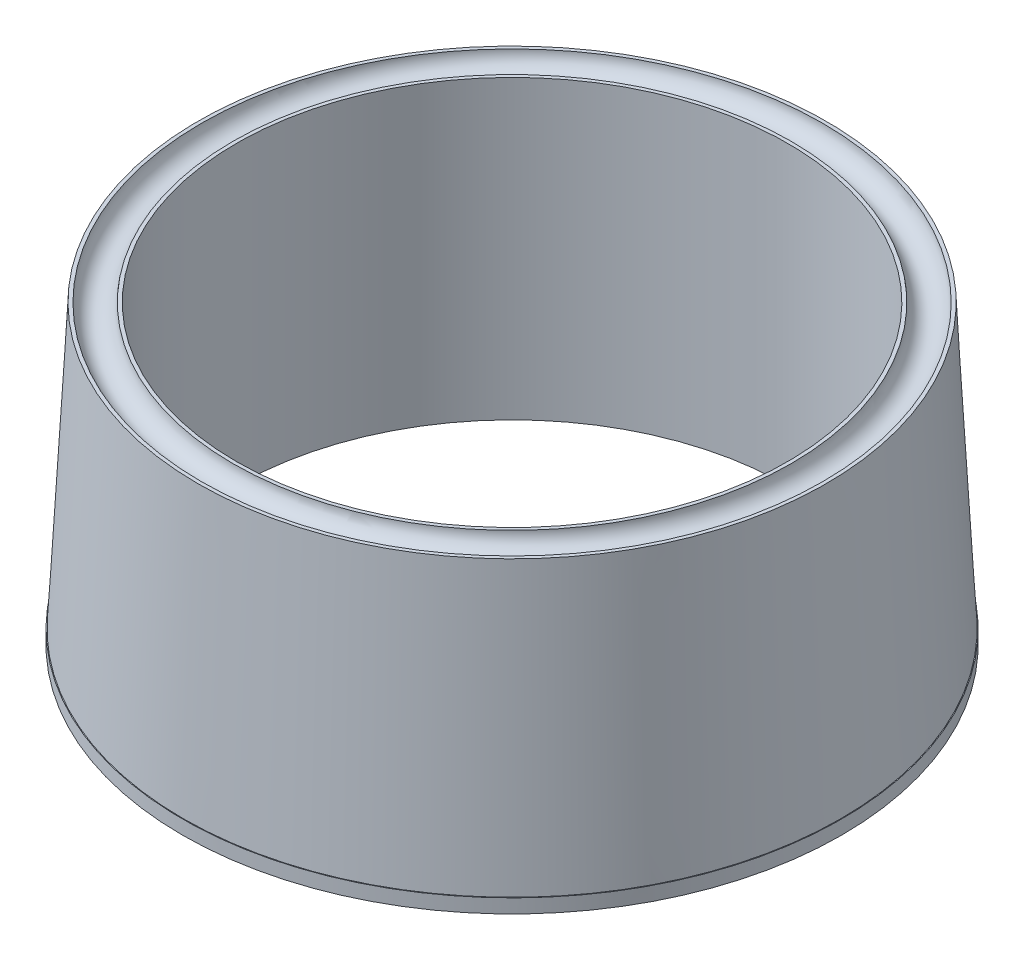
from build123d import *

# Parameters (mm, degrees)
SKETCH1_R            = 45
BOSS_EXTRUDE1_DEPTH  = 42.5
SKETCH2_R            = 39.5
CUT_EXTRUDE1_DEPTH   = 148
DRAFT2_ANGLE         = 3
CUT_EXTRUDE2_DEPTH   = 5
SKETCH7_R            = 47.22733062
BOSS_EXTRUDE2_DEPTH  = 2
SKETCH8_R            = 39.5
CUT_EXTRUDE3_DEPTH   = 66
SKETCH9_R            = 1.6
CUT_EXTRUDE4_DEPTH   = 15
CUT_SWEEP1_PROFILE_R = 2.25


with BuildPart() as part:
    # Sketch1 → Boss-Extrude1 (new body)
    with BuildSketch(Plane(origin=(0, 0, 0), x_dir=(1, 0, 0), z_dir=(0, 1, 0))):
        Circle(SKETCH1_R)
    extrude(amount=BOSS_EXTRUDE1_DEPTH)

    # Sketch2 → Cut-Extrude1 (cut)
    with BuildSketch(Plane(origin=(0, 42.5, 0), x_dir=(1, 0, 0), z_dir=(0, 1, 0))):
        Circle(SKETCH2_R)
    extrude(amount=-CUT_EXTRUDE1_DEPTH, mode=Mode.SUBTRACT)

    # Draft2
    draft2_faces = [part.faces().sort_by_distance(p)[0] for p in [
        (-45, 21.25, 0),
    ]]
    draft(draft2_faces, Plane.ZX.offset(42.5), DRAFT2_ANGLE)

    # Sketch6 → Cut-Extrude2 (cut)
    with BuildSketch(Plane.XZ):
        Polygon((-40.56366531, 1.616580754), (-43.36366531, 3.233161507), (-46.16366531, 1.616580754), (-46.16366531, -1.616580754), (-43.36366531, -3.233161507), (-40.56366531, -1.616580754), align=None)
        Polygon((-21.681832655, -34.320874252), (-24.481832655, -35.937455006), (-24.481832655, -39.170616513), (-21.681832655, -40.787197267), (-18.881832655, -39.170616513), (-18.881832655, -35.937455006), align=None)
        Polygon((-24.481832655, 35.937455006), (-21.681832655, 34.320874252), (-18.881832655, 35.937455006), (-18.881832655, 39.170616513), (-21.681832655, 40.787197267), (-24.481832655, 39.170616513), align=None)
        Polygon((18.881832655, -35.937455006), (18.881832655, -39.170616513), (21.681832655, -40.787197267), (24.481832655, -39.170616513), (24.481832655, -35.937455006), (21.681832655, -34.320874252), align=None)
        Polygon((18.881832655, 39.170616513), (18.881832655, 35.937455006), (21.681832655, 34.320874252), (24.481832655, 35.937455006), (24.481832655, 39.170616513), (21.681832655, 40.787197267), align=None)
        Polygon((40.56366531, -1.616580754), (43.36366531, -3.233161507), (46.16366531, -1.616580754), (46.16366531, 1.616580754), (43.36366531, 3.233161507), (40.56366531, 1.616580754), align=None)
    extrude(amount=-CUT_EXTRUDE2_DEPTH, mode=Mode.SUBTRACT)

    # Sketch7 → Boss-Extrude2 (add)
    with BuildSketch(Plane.XZ):
        Circle(SKETCH7_R)
    extrude(amount=-BOSS_EXTRUDE2_DEPTH)

    # Sketch8 → Cut-Extrude3 (cut)
    with BuildSketch(Plane(origin=(0, 2, 0), x_dir=(1, 0, 0), z_dir=(0, 1, 0))):
        Circle(SKETCH8_R)
    extrude(amount=-CUT_EXTRUDE3_DEPTH, mode=Mode.SUBTRACT)

    # Sketch9 → Cut-Extrude4 (cut)
    with BuildSketch(Plane.XZ):
        with Locations((-43.285053641, 0)):
            Circle(SKETCH9_R)
        with Locations((-21.64252682, -37.485956057)):
            Circle(SKETCH9_R)
        with Locations((-21.64252682, 37.485956057)):
            Circle(SKETCH9_R)
        with Locations((21.64252682, -37.485956057)):
            Circle(SKETCH9_R)
        with Locations((21.64252682, 37.485956057)):
            Circle(SKETCH9_R)
        with Locations((43.285053641, 0)):
            Circle(SKETCH9_R)
    extrude(amount=-CUT_EXTRUDE4_DEPTH, mode=Mode.SUBTRACT)

    # Cut-Sweep1: sweep along a path in Sketch10
    with BuildLine(Plane(origin=(0, 42.5, 0), x_dir=(1, 0, 0), z_dir=(0, 1, 0))) as cut_sweep1_path:
        CenterArc((0, 0), 42.25, 0, 360)
    # Cut-Sweep1 profile (on start of the path) → Cut-Sweep1 (sweep, cut)
    with BuildSketch(Plane(origin=(42.25, 42.5, 0), x_dir=(-1, 0, 0), z_dir=(0, 0, -1))):
        Circle(CUT_SWEEP1_PROFILE_R)
    sweep(path=cut_sweep1_path.line, mode=Mode.SUBTRACT)


solid = part.part
